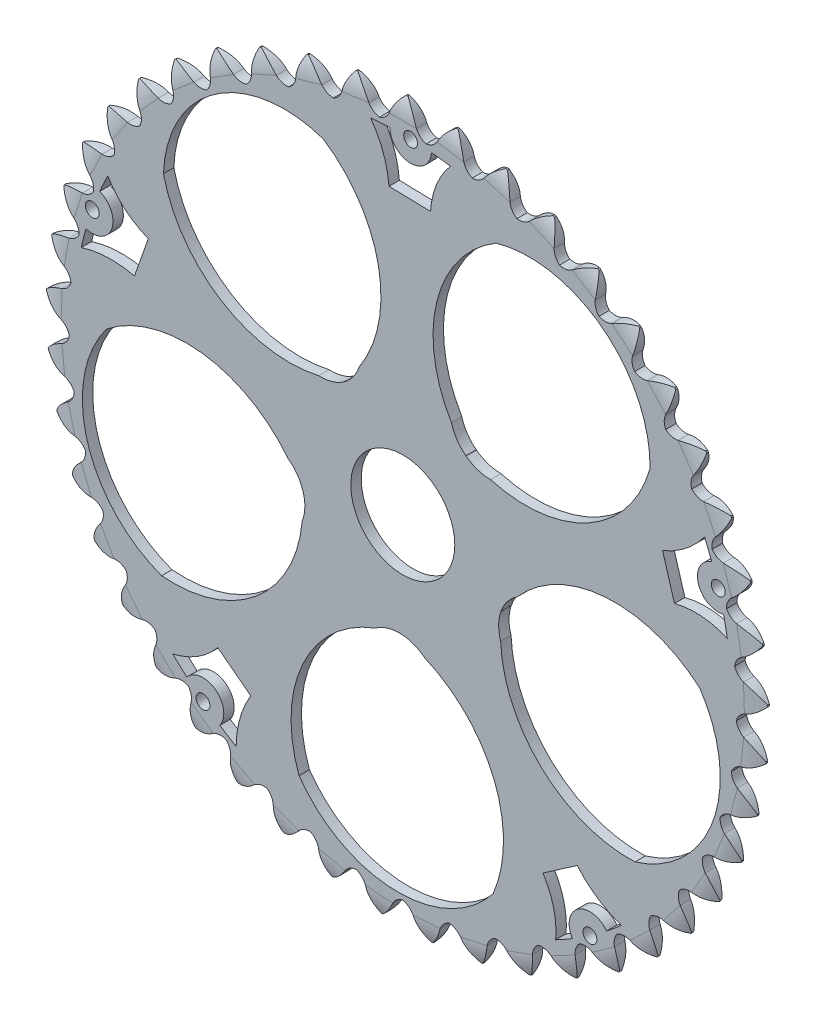
from build123d import *

# Parameters (mm, degrees)
EXTRUDE_1_DEPTH          = 1.5
CUT_EXTRUDE_1_DEPTH      = 12
PATTERN_CIRCULAR_1_COUNT = 45
SKETCH_19_R              = 96.2
EXTRUDE_2_DEPTH          = 1.5
CUT_EXTRUDE_3_DEPTH      = 248.545762617
CUT_EXTRUDE_3_DEPTH_BACK = 248.545762617
SKETCH_21_R              = 30
SKETCH_23_R              = 1.999999997
CUT_EXTRUDE_5_DEPTH      = 248.559396085
SKETCH_26_R              = 30
SKETCH_26_R_2            = 15
EXTRUDE_5_DEPTH          = 1.5
CUT_EXTRUDE_6_DEPTH      = 1.5
CUT_EXTRUDE_1_2_DEPTH    = 5


with BuildPart() as part:
    # 草图10 → 凸台-拉伸1 (new, symmetric)
    with BuildSketch(Plane.XY):
        with BuildLine():
            Line((-74.190652945, 172.030146872), (-73.690652945, 172.030146872))
            ThreePointArc((-73.690652945, 172.030146872), (-71.518276647, 169.441971215), (-70.003246556, 166.421614309))
            ThreePointArc((-70.003246556, 166.421614309), (-68.561023424, 164.618458036), (-66.392887936, 163.824374529))
            ThreePointArc((-66.392887936, 163.824374529), (-73.940652945, 164.120927024), (-81.488417954, 163.824374529))
            ThreePointArc((-81.488417954, 163.824374529), (-79.320282467, 164.618458036), (-77.878059334, 166.421614309))
            ThreePointArc((-77.878059334, 166.421614309), (-76.363029244, 169.441971215), (-74.190652945, 172.030146872))
        make_face()
    extrude_1 = extrude(amount=EXTRUDE_1_DEPTH, both=True)

    # 草图18 → Cut-Extrude 1 (cut, symmetric)
    with BuildSketch(Plane(origin=(-73.940652945, 0, 0), x_dir=(0, 0, -1), z_dir=(1, 0, 0))):
        with BuildLine():
            ThreePointArc((-1.5, 166.421614309), (-1.183712778, 169.294684858), (-0.25, 172.030146872))
            Line((-0.25, 172.030146872), (0.25, 172.030146872))
            ThreePointArc((0.25, 172.030146872), (1.183712778, 169.294684858), (1.5, 166.421614309))
            Line((1.5, 166.421614309), (2.384275184, 166.421614309))
            Line((2.384275184, 166.421614309), (2.384275184, 173.377134005))
            Line((2.384275184, 173.377134005), (-2.446359753, 173.377134005))
            Line((-2.446359753, 173.377134005), (-2.384275184, 166.421614309))
            Line((-2.384275184, 166.421614309), (-1.5, 166.421614309))
        make_face()
    cut_extrude_1 = extrude(amount=CUT_EXTRUDE_1_DEPTH, both=True, mode=Mode.SUBTRACT)

    # 阵列(圆周)1: 凸台-拉伸1, Cut-Extrude 1 ×45 about axis
    pattern_circular_1_axis = Axis((-73.940652945, 67.920927024, 1.5), (0, 0, -1))
    add([extrude_1.rotate(pattern_circular_1_axis, i * 360 / PATTERN_CIRCULAR_1_COUNT) for i in range(1, PATTERN_CIRCULAR_1_COUNT)])
    add([cut_extrude_1.rotate(pattern_circular_1_axis, i * 360 / PATTERN_CIRCULAR_1_COUNT) for i in range(1, PATTERN_CIRCULAR_1_COUNT)], mode=Mode.SUBTRACT)

    # 草图19 → 凸台-拉伸2 (add, symmetric)
    with BuildSketch(Plane.XY):
        with Locations((-73.940652945, 67.920927024)):
            Circle(SKETCH_19_R)
    extrude(amount=EXTRUDE_2_DEPTH, both=True)

    # 草图21 → 切除-拉伸3 (cut, two sides: drawn at the far end of the back side and taken through both)
    with BuildSketch(Plane.XY.offset(-CUT_EXTRUDE_3_DEPTH_BACK)):
        with Locations((-73.940652945, 67.920927024)):
            Circle(SKETCH_21_R)
    extrude(amount=CUT_EXTRUDE_3_DEPTH + CUT_EXTRUDE_3_DEPTH_BACK, mode=Mode.SUBTRACT)

    # 草图23 → 切除-拉伸5 (cut, through all)
    with BuildSketch(Plane.XY.offset(1.5)):
        with BuildLine():
            ThreePointArc((-161.399327172, 105.015135526), (-157.908255671, 97.435230223), (-165.374208176, 93.706678514))
            ThreePointArc((-165.374208176, 93.706678514), (-166.085993253, 91.034478496), (-166.719699413, 88.342693319))
            ThreePointArc((-166.719699413, 88.342693319), (-159.081437938, 89.664481258), (-151.36853519, 88.889050461))
            Line((-151.36853519, 88.889050461), (-147.389238956, 100.210068717))
            ThreePointArc((-147.389238956, 100.210068717), (-154.055948651, 104.160725438), (-159.085255488, 110.056383113))
            ThreePointArc((-159.085255488, 110.056383113), (-160.279093586, 107.55265257), (-161.399327172, 105.015135526))
        make_face()
        with Locations((-163.565302122, 99.423661221)):
            Circle(SKETCH_23_R)
        with BuildLine():
            Line((-77.925313969, 148.038725458), (-65.928715623, 147.752576879))
            ThreePointArc((-65.928715623, 147.752576879), (-64.231544397, 155.313814642), (-60.17858203, 161.918828097))
            ThreePointArc((-60.17858203, 161.918828097), (-62.928687539, 162.280540312), (-65.688180874, 162.561809874))
            ThreePointArc((-65.688180874, 162.561809874), (-71.818298784, 156.89928402), (-77.671468385, 162.847640957))
            ThreePointArc((-77.671468385, 162.847640957), (-80.432835311, 162.698833574), (-83.188701117, 162.469716582))
            ThreePointArc((-83.188701117, 162.469716582), (-79.571253481, 155.61375317), (-77.925313969, 148.038725458))
        make_face()
        with BuildLine():
            Line((1.024573354, 96.468326123), (4.459582646, 84.97045832))
            ThreePointArc((4.459582646, 84.97045832), (12.175201844, 85.692903533), (19.709377179, 83.879368669))
            ThreePointArc((19.709377179, 83.879368669), (19.203556599, 86.606649655), (18.618329513, 89.318000849))
            ThreePointArc((18.618329513, 89.318000849), (11.338636789, 93.398272712), (15.187131537, 100.803111184))
            ThreePointArc((15.187131537, 100.803111184), (14.192297999, 103.383343183), (13.122785422, 105.933526271))
            ThreePointArc((13.122785422, 105.933526271), (7.720229539, 100.374519917), (1.024573354, 96.468326123))
        make_face()
        with BuildLine():
            ThreePointArc((-127.346312848, 8.045064203), (-133.163737259, 2.925466571), (-140.324982191, -0.035830054))
            ThreePointArc((-140.324982191, -0.035830054), (-138.312709204, -1.944932844), (-136.2455583, -3.794474186))
            ThreePointArc((-136.2455583, -3.794474186), (-127.957839546, -2.816587441), (-126.71888235, -11.069316062))
            ThreePointArc((-126.71888235, -11.069316062), (-124.397422795, -12.572019116), (-122.033208934, -14.006516854))
            ThreePointArc((-122.033208934, -14.006516854), (-120.929951364, -6.333643569), (-117.809054826, 0.762141554))
            Line((-117.809054826, 0.762141554), (-127.346312848, 8.045064203))
        make_face()
        with Locations((-71.675312016, 162.89391388)):
            Circle(SKETCH_23_R)
        with Locations((-131.597073295, -7.58229936)):
            Circle(SKETCH_23_R)
        with Locations((17.084053922, 95.114726717)):
            Circle(SKETCH_23_R)
        with BuildLine():
            ThreePointArc((-15.125837353, -6.683479474), (-12.979311368, -4.940001017), (-10.884440685, -3.134784199))
            ThreePointArc((-10.884440685, -3.134784199), (-17.840851483, 0.285524343), (-23.624934095, 5.446391524))
            Line((-23.624934095, 5.446391524), (-33.498579946, -1.373532998))
            ThreePointArc((-33.498579946, -1.373532998), (-30.427236264, -8.488275064), (-29.823822197, -16.214114705))
            ThreePointArc((-29.823822197, -16.214114705), (-27.386330998, -14.890274573), (-24.988527893, -13.495836943))
            ThreePointArc((-24.988527893, -13.495836943), (-23.357507515, -5.311564394), (-15.125837353, -6.683479474))
        make_face()
        with Locations((-19.949631215, -10.245367339)):
            Circle(SKETCH_23_R)
    extrude(amount=-CUT_EXTRUDE_5_DEPTH, mode=Mode.SUBTRACT)

    # 草图26 → 凸台-拉伸5 (add, symmetric)
    with BuildSketch(Plane.XY):
        with Locations((-73.940652945, 67.920927024)):
            Circle(SKETCH_26_R)
        with Locations((-73.940652945, 67.920927024)):
            Circle(SKETCH_26_R_2, mode=Mode.SUBTRACT)
    extrude(amount=EXTRUDE_5_DEPTH, both=True)

    # 草图27 → 切除-拉伸6 (cut, symmetric)
    with BuildSketch(Plane.XY):
        with BuildLine():
            ThreePointArc((-47.034553853, 149.290829329), (-16.246045562, 143.395247997), (-2.599603866, 115.173540906))
            ThreePointArc((-2.599603866, 115.173540906), (-25.233490505, 94.541874506), (-55.73336231, 91.764051143))
            ThreePointArc((-55.73336231, 91.764051143), (-60.901079451, 121.966554653), (-47.034553853, 149.290829329))
        make_face()
        with BuildLine():
            ThreePointArc((11.761164744, 67.476388797), (15.668305994, 36.372942536), (-6.955150038, 14.673418136))
            ThreePointArc((-6.955150038, 14.673418136), (-33.57128643, 29.823987973), (-45.638132156, 57.972695173))
            ThreePointArc((-45.638132156, 57.972695173), (-18.510756802, 72.220573091), (11.761164744, 67.476388797))
        make_face()
        with BuildLine():
            ThreePointArc((-47.880115808, -13.723715014), (-76.253878008, -27.051120639), (-103.882384475, -12.240457168))
            ThreePointArc((-103.882384475, -12.240457168), (-97.698174776, 17.754776341), (-74.656023765, 37.929457494))
            ThreePointArc((-74.656023765, 37.929457494), (-52.722666631, 16.532626804), (-47.880115808, -13.723715014))
        make_face()
        with BuildLine():
            ThreePointArc((-143.536172918, 17.906301472), (-164.979263597, 40.772958075), (-159.43116362, 71.625975896))
            ThreePointArc((-159.43116362, 71.625975896), (-128.99297544, 75.013479868), (-102.685297216, 59.333411332))
            ThreePointArc((-102.685297216, 59.333411332), (-116.257112373, 31.861564797), (-143.536172918, 17.906301472))
        make_face()
        with BuildLine():
            ThreePointArc((-143.013586891, 118.654830536), (-127.892383554, 146.114607151), (-96.834962728, 150.372157349))
            ThreePointArc((-96.834962728, 150.372157349), (-84.207337576, 122.470516432), (-90.99044928, 92.605019978))
            ThreePointArc((-90.99044928, 92.605019978), (-121.31164947, 97.023315775), (-143.013586891, 118.654830536))
        make_face()
    extrude(amount=CUT_EXTRUDE_6_DEPTH, both=True, mode=Mode.SUBTRACT)

    # 草图29 → Cut-Extrude 1 2 (cut, symmetric)
    with BuildSketch(Plane.XY):
        with BuildLine():
            ThreePointArc((-96.834962728, 150.372157349), (-80.963540537, 126.638613354), (-86.522900178, 98.633673196))
            ThreePointArc((-86.522900178, 98.633673196), (-90.996889715, 92.614344212), (-98.210253575, 90.560984623))
            ThreePointArc((-98.210253575, 90.560984623), (-126.430346231, 95.32883343), (-143.013586891, 118.654830536))
            Line((-143.013586891, 118.654830536), (-133.266376789, 120.889085498))
            ThreePointArc((-133.266376789, 120.889085498), (-120.273658069, 103.292561998), (-98.540699037, 100.81731034))
            ThreePointArc((-98.540699037, 100.81731034), (-96.677892753, 100.843940641), (-95.999248947, 102.578933152))
            ThreePointArc((-95.999248947, 102.578933152), (-90.594591232, 123.708618463), (-102.387474443, 142.05533021))
            Line((-102.387474443, 142.05533021), (-96.834962728, 150.372157349))
        make_face()
        with BuildLine():
            ThreePointArc((-47.034553853, 149.290829329), (-64.094392214, 126.311100722), (-59.908397678, 97.998851402))
            ThreePointArc((-59.908397678, 97.998851402), (-55.72648464, 91.773057707), (-48.619223788, 89.378115755))
            ThreePointArc((-48.619223788, 89.378115755), (-20.267006354, 92.744852977), (-2.599603866, 115.173540906))
            Line((-2.599603866, 115.173540906), (-12.225196993, 117.884252429))
            ThreePointArc((-12.225196993, 117.884252429), (-26.029755427, 100.999108285), (-47.795411412, 99.609811376))
            ThreePointArc((-47.795411412, 99.609811376), (-49.655199814, 99.719097819), (-50.256165535, 101.482502659))
            ThreePointArc((-50.256165535, 101.482502659), (-54.617914995, 122.916669792), (-41.897597544, 140.711104399))
            Line((-41.897597544, 140.711104399), (-47.034553853, 149.290829329))
        make_face()
        with BuildLine():
            ThreePointArc((11.761164744, 67.476388797), (-15.365635866, 76.600132572), (-40.998641621, 63.870049002))
            ThreePointArc((-40.998641621, 63.870049002), (-45.627441087, 57.968937302), (-45.70890185, 50.469452791))
            ThreePointArc((-45.70890185, 50.469452791), (-33.745627461, 24.545270667), (-6.955150038, 14.673418136))
            Line((-6.955150038, 14.673418136), (-7.351582038, 24.66555713))
            ThreePointArc((-7.351582038, 24.66555713), (-27.676151561, 32.576675891), (-35.723409032, 52.847728491))
            ThreePointArc((-35.723409032, 52.847728491), (-36.194177671, 54.650263738), (-34.702788627, 55.766738166))
            ThreePointArc((-34.702788627, 55.766738166), (-15.665539013, 66.538530317), (5.18876824, 59.939572215))
            Line((5.18876824, 59.939572215), (11.761164744, 67.476388797))
        make_face()
        with BuildLine():
            ThreePointArc((-47.880115808, -13.723715014), (-47.585562229, 14.89479735), (-67.613625557, 35.339422343))
            ThreePointArc((-67.613625557, 35.339422343), (-74.656293991, 37.918128437), (-81.813900364, 35.678134063))
            ThreePointArc((-81.813900364, 35.678134063), (-102.772407608, 16.289371158), (-103.882384475, -12.240457168))
            Line((-103.882384475, -12.240457168), (-94.501799798, -8.775687172))
            ThreePointArc((-94.501799798, -8.775687172), (-93.258516135, 12.998797255), (-76.466338784, 26.916293659))
            ThreePointArc((-76.466338784, 26.916293659), (-74.897501402, 27.921035265), (-73.374806562, 26.847649569))
            ThreePointArc((-73.374806562, 26.847649569), (-57.247389787, 12.070816105), (-57.079036544, -9.8019989))
            Line((-57.079036544, -9.8019989), (-47.880115808, -13.723715014))
        make_face()
        with BuildLine():
            ThreePointArc((-143.536172918, 17.906301472), (-116.227328186, 26.469771046), (-102.972346296, 51.835327749))
            ThreePointArc((-102.972346296, 51.835327749), (-102.696155294, 59.330167461), (-107.038338547, 65.445259315))
            ThreePointArc((-107.038338547, 65.445259315), (-131.954682767, 79.386526964), (-159.43116362, 71.625975896))
            Line((-159.43116362, 71.625975896), (-153.237211455, 63.775182523))
            ThreePointArc((-153.237211455, 63.775182523), (-132.144250371, 69.321435226), (-113.718856552, 57.651868441))
            ThreePointArc((-113.718856552, 57.651868441), (-112.278493088, 56.470297657), (-112.828804966, 54.690434385))
            ThreePointArc((-112.828804966, 54.690434385), (-121.898762863, 34.786056907), (-142.64902209, 27.866871907))
            Line((-142.64902209, 27.866871907), (-143.536172918, 17.906301472))
        make_face()
    extrude(amount=CUT_EXTRUDE_1_2_DEPTH, both=True, mode=Mode.SUBTRACT)


solid = part.part
